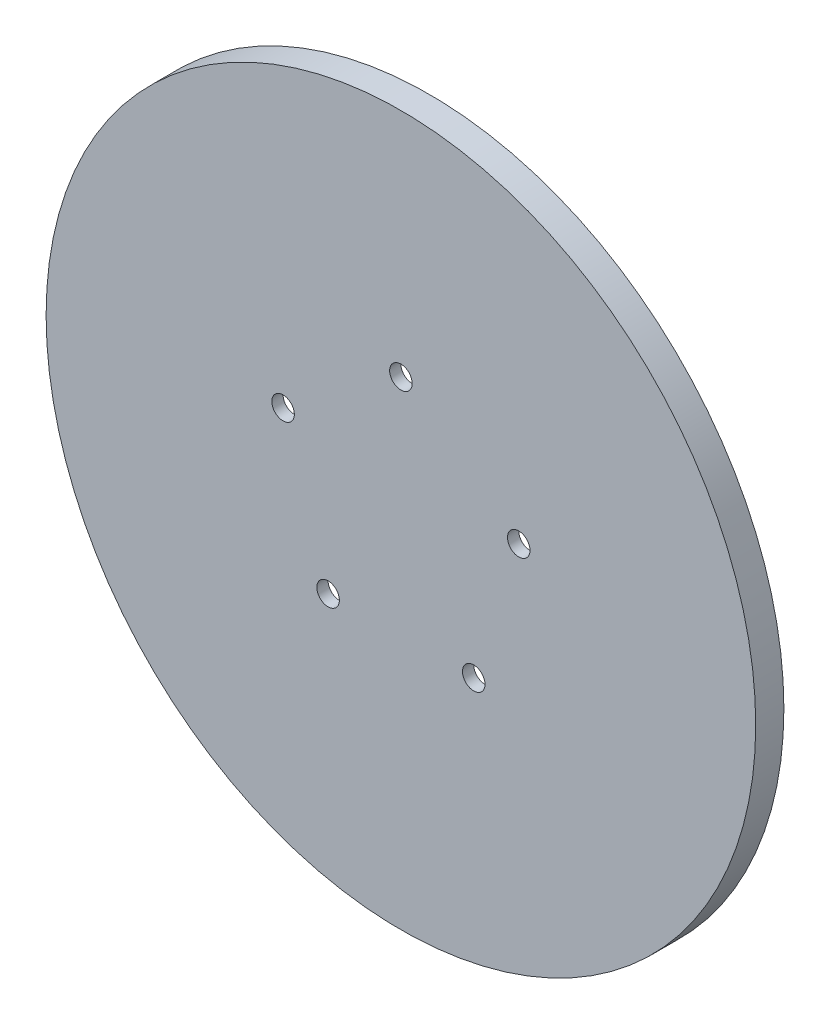
from build123d import *

# Parameters (mm, degrees)
SKETCH1_R           = 7.9375
BOSS_EXTRUDE2_DEPTH = 4.0894
SKETCH4_R           = 80.01
SKETCH4_R_2         = 75.421450769
BOSS_EXTRUDE3_DEPTH = 3.81
BOSS_EXTRUDE5_START = -3.81
BOSS_EXTRUDE5_DEPTH = 3.81
SKETCH6_R           = 80.01
BOSS_EXTRUDE6_DEPTH = 2.54
BOSS_EXTRUDE7_START = 3.81
SKETCH8_R           = 7.9375
BOSS_EXTRUDE7_DEPTH = 3.81
SKETCH9_R           = 2.54
CUT_EXTRUDE2_DEPTH  = 117.930855287


with BuildPart() as part:
    # Sketch1 → Boss-Extrude2 (new body)
    with BuildSketch(Plane.XY):
        with BuildLine():
            Line((-0.762, 75.421450769), (0.762, 75.421450769))
            Line((0.762, 75.421450769), (1.456984931, 73.511995363))
            ThreePointArc((1.456984931, 73.511995363), (2.339997211, 71.173530048), (4.594157789, 70.093302846))
            ThreePointArc((4.594157789, 70.093302846), (6.970031654, 70.870061558), (8.150720614, 73.073264748))
            Line((8.150720614, 73.073264748), (9.088993796, 74.875670761))
            Line((9.088993796, 74.875670761), (10.599955765, 74.676748844))
            Line((10.599955765, 74.676748844), (11.03976106, 72.692915357))
            ThreePointArc((11.03976106, 72.692915357), (11.609988074, 70.259199706), (13.703866053, 68.893987001))
            ThreePointArc((13.703866053, 68.893987001), (16.160801344, 69.353986665), (17.61896507, 71.384230312))
            Line((17.61896507, 71.384230312), (18.784472389, 73.048747266))
            Line((18.784472389, 73.048747266), (20.256543348, 72.654307042))
            Line((20.256543348, 72.654307042), (20.433643817, 70.630039415))
            ThreePointArc((20.433643817, 70.630039415), (20.681328823, 68.142714978), (22.579097369, 66.515875937))
            ThreePointArc((22.579097369, 66.515875937), (25.075055243, 66.651245832), (26.785744149, 68.473791905))
            Line((26.785744149, 68.473791905), (28.15854345, 69.971939453))
            Line((28.15854345, 69.971939453), (29.566535858, 69.388729902))
            Line((29.566535858, 69.388729902), (29.477901263, 67.358663916))
            ThreePointArc((29.477901263, 67.358663916), (29.398806302, 64.860289504), (31.067994069, 62.999659794))
            ThreePointArc((31.067994069, 62.999659794), (33.560267995, 62.808083704), (35.494211718, 64.391747933))
            Line((35.494211718, 64.391747933), (37.050814027, 65.697892356))
            Line((37.050814027, 65.697892356), (38.370636742, 64.935892356))
            Line((38.370636742, 64.935892356), (38.017783645, 62.934763002))
            ThreePointArc((38.017783645, 62.934763002), (37.613262053, 60.468086493), (39.025308777, 58.405502006))
            ThreePointArc((39.025308777, 58.405502006), (41.471255256, 57.89025785), (43.595363485, 59.207943302))
            Line((43.595363485, 59.207943302), (45.309134903, 60.299736106))
            Line((45.309134903, 60.299736106), (46.518205393, 59.371983688))
            Line((46.518205393, 59.371983688), (45.907171209, 57.434030844))
            ThreePointArc((45.907171209, 57.434030844), (45.184144463, 55.041257758), (46.314889632, 52.812009885))
            ThreePointArc((46.314889632, 52.812009885), (48.672657842, 51.981913634), (50.950586495, 53.011074345))
            Line((50.950586495, 53.011074345), (52.792203918, 53.869834653))
            Line((52.792203918, 53.869834653), (53.869834653, 52.792203918))
            Line((53.869834653, 52.792203918), (53.011074345, 50.950586495))
            ThreePointArc((53.011074345, 50.950586495), (51.981913634, 48.672657842), (52.812009885, 46.314889632))
            ThreePointArc((52.812009885, 46.314889632), (55.041257758, 45.184144463), (57.434030844, 45.907171209))
            Line((57.434030844, 45.907171209), (59.371983688, 46.518205393))
            Line((59.371983688, 46.518205393), (60.299736106, 45.309134903))
            Line((60.299736106, 45.309134903), (59.207943302, 43.595363485))
            ThreePointArc((59.207943302, 43.595363485), (57.89025785, 41.471255256), (58.405502006, 39.025308777))
            ThreePointArc((58.405502006, 39.025308777), (60.468086493, 37.613262053), (62.934763002, 38.017783645))
            Line((62.934763002, 38.017783645), (64.935892356, 38.370636742))
            Line((64.935892356, 38.370636742), (65.697892356, 37.050814027))
            Line((65.697892356, 37.050814027), (64.391747933, 35.494211718))
            ThreePointArc((64.391747933, 35.494211718), (62.808083704, 33.560267995), (62.999659794, 31.067994069))
            ThreePointArc((62.999659794, 31.067994069), (64.860289504, 29.398806302), (67.358663916, 29.477901263))
            Line((67.358663916, 29.477901263), (69.388729902, 29.566535858))
            Line((69.388729902, 29.566535858), (69.971939453, 28.15854345))
            Line((69.971939453, 28.15854345), (68.473791905, 26.785744149))
            ThreePointArc((68.473791905, 26.785744149), (66.651245832, 25.075055243), (66.515875937, 22.579097369))
            ThreePointArc((66.515875937, 22.579097369), (68.142714978, 20.681328823), (70.630039415, 20.433643817))
            Line((70.630039415, 20.433643817), (72.654307042, 20.256543348))
            Line((72.654307042, 20.256543348), (73.048747266, 18.784472389))
            Line((73.048747266, 18.784472389), (71.384230312, 17.61896507))
            ThreePointArc((71.384230312, 17.61896507), (69.353986665, 16.160801344), (68.893987001, 13.703866053))
            ThreePointArc((68.893987001, 13.703866053), (70.259199706, 11.609988074), (72.692915357, 11.03976106))
            Line((72.692915357, 11.03976106), (74.676748844, 10.599955765))
            Line((74.676748844, 10.599955765), (74.875670761, 9.088993796))
            Line((74.875670761, 9.088993796), (73.073264748, 8.150720614))
            ThreePointArc((73.073264748, 8.150720614), (70.870061558, 6.970031654), (70.093302846, 4.594157789))
            ThreePointArc((70.093302846, 4.594157789), (71.173530048, 2.339997211), (73.511995363, 1.456984931))
            Line((73.511995363, 1.456984931), (75.421450769, 0.762))
            Line((75.421450769, 0.762), (75.421450769, -0.762))
            Line((75.421450769, -0.762), (73.511995363, -1.456984931))
            ThreePointArc((73.511995363, -1.456984931), (71.173530048, -2.339997211), (70.093302846, -4.594157789))
            ThreePointArc((70.093302846, -4.594157789), (70.870061558, -6.970031654), (73.073264748, -8.150720614))
            Line((73.073264748, -8.150720614), (74.875670761, -9.088993796))
            Line((74.875670761, -9.088993796), (74.676748844, -10.599955765))
            Line((74.676748844, -10.599955765), (72.692915357, -11.03976106))
            ThreePointArc((72.692915357, -11.03976106), (70.259199706, -11.609988074), (68.893987001, -13.703866053))
            ThreePointArc((68.893987001, -13.703866053), (69.353986665, -16.160801344), (71.384230312, -17.61896507))
            Line((71.384230312, -17.61896507), (73.048747266, -18.784472389))
            Line((73.048747266, -18.784472389), (72.654307042, -20.256543348))
            Line((72.654307042, -20.256543348), (70.630039415, -20.433643817))
            ThreePointArc((70.630039415, -20.433643817), (68.142714978, -20.681328823), (66.515875937, -22.579097369))
            ThreePointArc((66.515875937, -22.579097369), (66.651245832, -25.075055243), (68.473791905, -26.785744149))
            Line((68.473791905, -26.785744149), (69.971939453, -28.15854345))
            Line((69.971939453, -28.15854345), (69.388729902, -29.566535858))
            Line((69.388729902, -29.566535858), (67.358663916, -29.477901263))
            ThreePointArc((67.358663916, -29.477901263), (64.860289504, -29.398806302), (62.999659794, -31.067994069))
            ThreePointArc((62.999659794, -31.067994069), (62.808083704, -33.560267995), (64.391747933, -35.494211718))
            Line((64.391747933, -35.494211718), (65.697892356, -37.050814027))
            Line((65.697892356, -37.050814027), (64.935892356, -38.370636742))
            Line((64.935892356, -38.370636742), (62.934763002, -38.017783645))
            ThreePointArc((62.934763002, -38.017783645), (60.468086493, -37.613262053), (58.405502006, -39.025308777))
            ThreePointArc((58.405502006, -39.025308777), (57.89025785, -41.471255256), (59.207943302, -43.595363485))
            Line((59.207943302, -43.595363485), (60.299736106, -45.309134903))
            Line((60.299736106, -45.309134903), (59.371983688, -46.518205393))
            Line((59.371983688, -46.518205393), (57.434030844, -45.907171209))
            ThreePointArc((57.434030844, -45.907171209), (55.041257758, -45.184144463), (52.812009885, -46.314889632))
            ThreePointArc((52.812009885, -46.314889632), (51.981913634, -48.672657842), (53.011074345, -50.950586495))
            Line((53.011074345, -50.950586495), (53.869834653, -52.792203918))
            Line((53.869834653, -52.792203918), (52.792203918, -53.869834653))
            Line((52.792203918, -53.869834653), (50.950586495, -53.011074345))
            ThreePointArc((50.950586495, -53.011074345), (48.672657842, -51.981913634), (46.314889632, -52.812009885))
            ThreePointArc((46.314889632, -52.812009885), (45.184144463, -55.041257758), (45.907171209, -57.434030844))
            Line((45.907171209, -57.434030844), (46.518205393, -59.371983688))
            Line((46.518205393, -59.371983688), (45.309134903, -60.299736106))
            Line((45.309134903, -60.299736106), (43.595363485, -59.207943302))
            ThreePointArc((43.595363485, -59.207943302), (41.471255256, -57.89025785), (39.025308777, -58.405502006))
            ThreePointArc((39.025308777, -58.405502006), (37.613262053, -60.468086493), (38.017783645, -62.934763002))
            Line((38.017783645, -62.934763002), (38.370636742, -64.935892356))
            Line((38.370636742, -64.935892356), (37.050814027, -65.697892356))
            Line((37.050814027, -65.697892356), (35.494211718, -64.391747933))
            ThreePointArc((35.494211718, -64.391747933), (33.560267995, -62.808083704), (31.067994069, -62.999659794))
            ThreePointArc((31.067994069, -62.999659794), (29.398806302, -64.860289504), (29.477901263, -67.358663916))
            Line((29.477901263, -67.358663916), (29.566535858, -69.388729902))
            Line((29.566535858, -69.388729902), (28.15854345, -69.971939453))
            Line((28.15854345, -69.971939453), (26.785744149, -68.473791905))
            ThreePointArc((26.785744149, -68.473791905), (25.075055243, -66.651245832), (22.579097369, -66.515875937))
            ThreePointArc((22.579097369, -66.515875937), (20.681328823, -68.142714978), (20.433643817, -70.630039415))
            Line((20.433643817, -70.630039415), (20.256543348, -72.654307042))
            Line((20.256543348, -72.654307042), (18.784472389, -73.048747266))
            Line((18.784472389, -73.048747266), (17.61896507, -71.384230312))
            ThreePointArc((17.61896507, -71.384230312), (16.160801344, -69.353986665), (13.703866053, -68.893987001))
            ThreePointArc((13.703866053, -68.893987001), (11.609988074, -70.259199706), (11.03976106, -72.692915357))
            Line((11.03976106, -72.692915357), (10.599955765, -74.676748844))
            Line((10.599955765, -74.676748844), (9.088993796, -74.875670761))
            Line((9.088993796, -74.875670761), (8.150720614, -73.073264748))
            ThreePointArc((8.150720614, -73.073264748), (6.970031654, -70.870061558), (4.594157789, -70.093302846))
            ThreePointArc((4.594157789, -70.093302846), (2.339997211, -71.173530048), (1.456984931, -73.511995363))
            Line((1.456984931, -73.511995363), (0.762, -75.421450769))
            Line((0.762, -75.421450769), (-0.762, -75.421450769))
            Line((-0.762, -75.421450769), (-1.456984931, -73.511995363))
            ThreePointArc((-1.456984931, -73.511995363), (-2.339997211, -71.173530048), (-4.594157789, -70.093302846))
            ThreePointArc((-4.594157789, -70.093302846), (-6.970031654, -70.870061558), (-8.150720614, -73.073264748))
            Line((-8.150720614, -73.073264748), (-9.088993796, -74.875670761))
            Line((-9.088993796, -74.875670761), (-10.599955765, -74.676748844))
            Line((-10.599955765, -74.676748844), (-11.03976106, -72.692915357))
            ThreePointArc((-11.03976106, -72.692915357), (-11.609988074, -70.259199706), (-13.703866053, -68.893987001))
            ThreePointArc((-13.703866053, -68.893987001), (-16.160801344, -69.353986665), (-17.61896507, -71.384230312))
            Line((-17.61896507, -71.384230312), (-18.784472389, -73.048747266))
            Line((-18.784472389, -73.048747266), (-20.256543348, -72.654307042))
            Line((-20.256543348, -72.654307042), (-20.433643817, -70.630039415))
            ThreePointArc((-20.433643817, -70.630039415), (-20.681328823, -68.142714978), (-22.579097369, -66.515875937))
            ThreePointArc((-22.579097369, -66.515875937), (-25.075055243, -66.651245832), (-26.785744149, -68.473791905))
            Line((-26.785744149, -68.473791905), (-28.15854345, -69.971939453))
            Line((-28.15854345, -69.971939453), (-29.566535858, -69.388729902))
            Line((-29.566535858, -69.388729902), (-29.477901263, -67.358663916))
            ThreePointArc((-29.477901263, -67.358663916), (-29.398806302, -64.860289504), (-31.067994069, -62.999659794))
            ThreePointArc((-31.067994069, -62.999659794), (-33.560267995, -62.808083704), (-35.494211718, -64.391747933))
            Line((-35.494211718, -64.391747933), (-37.050814027, -65.697892356))
            Line((-37.050814027, -65.697892356), (-38.370636742, -64.935892356))
            Line((-38.370636742, -64.935892356), (-38.017783645, -62.934763002))
            ThreePointArc((-38.017783645, -62.934763002), (-37.613262053, -60.468086493), (-39.025308777, -58.405502006))
            ThreePointArc((-39.025308777, -58.405502006), (-41.471255256, -57.89025785), (-43.595363485, -59.207943302))
            Line((-43.595363485, -59.207943302), (-45.309134903, -60.299736106))
            Line((-45.309134903, -60.299736106), (-46.518205393, -59.371983688))
            Line((-46.518205393, -59.371983688), (-45.907171209, -57.434030844))
            ThreePointArc((-45.907171209, -57.434030844), (-45.184144463, -55.041257758), (-46.314889632, -52.812009885))
            ThreePointArc((-46.314889632, -52.812009885), (-48.672657842, -51.981913634), (-50.950586495, -53.011074345))
            Line((-50.950586495, -53.011074345), (-52.792203918, -53.869834653))
            Line((-52.792203918, -53.869834653), (-53.869834653, -52.792203918))
            Line((-53.869834653, -52.792203918), (-53.011074345, -50.950586495))
            ThreePointArc((-53.011074345, -50.950586495), (-51.981913634, -48.672657842), (-52.812009885, -46.314889632))
            ThreePointArc((-52.812009885, -46.314889632), (-55.041257758, -45.184144463), (-57.434030844, -45.907171209))
            Line((-57.434030844, -45.907171209), (-59.371983688, -46.518205393))
            Line((-59.371983688, -46.518205393), (-60.299736106, -45.309134903))
            Line((-60.299736106, -45.309134903), (-59.207943302, -43.595363485))
            ThreePointArc((-59.207943302, -43.595363485), (-57.89025785, -41.471255256), (-58.405502006, -39.025308777))
            ThreePointArc((-58.405502006, -39.025308777), (-60.468086493, -37.613262053), (-62.934763002, -38.017783645))
            Line((-62.934763002, -38.017783645), (-64.935892356, -38.370636742))
            Line((-64.935892356, -38.370636742), (-65.697892356, -37.050814027))
            Line((-65.697892356, -37.050814027), (-64.391747933, -35.494211718))
            ThreePointArc((-64.391747933, -35.494211718), (-62.808083704, -33.560267995), (-62.999659794, -31.067994069))
            ThreePointArc((-62.999659794, -31.067994069), (-64.860289504, -29.398806302), (-67.358663916, -29.477901263))
            Line((-67.358663916, -29.477901263), (-69.388729902, -29.566535858))
            Line((-69.388729902, -29.566535858), (-69.971939453, -28.15854345))
            Line((-69.971939453, -28.15854345), (-68.473791905, -26.785744149))
            ThreePointArc((-68.473791905, -26.785744149), (-66.651245832, -25.075055243), (-66.515875937, -22.579097369))
            ThreePointArc((-66.515875937, -22.579097369), (-68.142714978, -20.681328823), (-70.630039415, -20.433643817))
            Line((-70.630039415, -20.433643817), (-72.654307042, -20.256543348))
            Line((-72.654307042, -20.256543348), (-73.048747266, -18.784472389))
            Line((-73.048747266, -18.784472389), (-71.384230312, -17.61896507))
            ThreePointArc((-71.384230312, -17.61896507), (-69.353986665, -16.160801344), (-68.893987001, -13.703866053))
            ThreePointArc((-68.893987001, -13.703866053), (-70.259199706, -11.609988074), (-72.692915357, -11.03976106))
            Line((-72.692915357, -11.03976106), (-74.676748844, -10.599955765))
            Line((-74.676748844, -10.599955765), (-74.875670761, -9.088993796))
            Line((-74.875670761, -9.088993796), (-73.073264748, -8.150720614))
            ThreePointArc((-73.073264748, -8.150720614), (-70.870061558, -6.970031654), (-70.093302846, -4.594157789))
            ThreePointArc((-70.093302846, -4.594157789), (-71.173530048, -2.339997211), (-73.511995363, -1.456984931))
            Line((-73.511995363, -1.456984931), (-75.421450769, -0.762))
            Line((-75.421450769, -0.762), (-75.421450769, 0.762))
            Line((-75.421450769, 0.762), (-73.511995363, 1.456984931))
            ThreePointArc((-73.511995363, 1.456984931), (-71.173530048, 2.339997211), (-70.093302846, 4.594157789))
            ThreePointArc((-70.093302846, 4.594157789), (-70.870061558, 6.970031654), (-73.073264748, 8.150720614))
            Line((-73.073264748, 8.150720614), (-74.875670761, 9.088993796))
            Line((-74.875670761, 9.088993796), (-74.676748844, 10.599955765))
            Line((-74.676748844, 10.599955765), (-72.692915357, 11.03976106))
            ThreePointArc((-72.692915357, 11.03976106), (-70.259199706, 11.609988074), (-68.893987001, 13.703866053))
            ThreePointArc((-68.893987001, 13.703866053), (-69.353986665, 16.160801344), (-71.384230312, 17.61896507))
            Line((-71.384230312, 17.61896507), (-73.048747266, 18.784472389))
            Line((-73.048747266, 18.784472389), (-72.654307042, 20.256543348))
            Line((-72.654307042, 20.256543348), (-70.630039415, 20.433643817))
            ThreePointArc((-70.630039415, 20.433643817), (-68.142714978, 20.681328823), (-66.515875937, 22.579097369))
            ThreePointArc((-66.515875937, 22.579097369), (-66.651245832, 25.075055243), (-68.473791905, 26.785744149))
            Line((-68.473791905, 26.785744149), (-69.971939453, 28.15854345))
            Line((-69.971939453, 28.15854345), (-69.388729902, 29.566535858))
            Line((-69.388729902, 29.566535858), (-67.358663916, 29.477901263))
            ThreePointArc((-67.358663916, 29.477901263), (-64.860289504, 29.398806302), (-62.999659794, 31.067994069))
            ThreePointArc((-62.999659794, 31.067994069), (-62.808083704, 33.560267995), (-64.391747933, 35.494211718))
            Line((-64.391747933, 35.494211718), (-65.697892356, 37.050814027))
            Line((-65.697892356, 37.050814027), (-64.935892356, 38.370636742))
            Line((-64.935892356, 38.370636742), (-62.934763002, 38.017783645))
            ThreePointArc((-62.934763002, 38.017783645), (-60.468086493, 37.613262053), (-58.405502006, 39.025308777))
            ThreePointArc((-58.405502006, 39.025308777), (-57.89025785, 41.471255256), (-59.207943302, 43.595363485))
            Line((-59.207943302, 43.595363485), (-60.299736106, 45.309134903))
            Line((-60.299736106, 45.309134903), (-59.371983688, 46.518205393))
            Line((-59.371983688, 46.518205393), (-57.434030844, 45.907171209))
            ThreePointArc((-57.434030844, 45.907171209), (-55.041257758, 45.184144463), (-52.812009885, 46.314889632))
            ThreePointArc((-52.812009885, 46.314889632), (-51.981913634, 48.672657842), (-53.011074345, 50.950586495))
            Line((-53.011074345, 50.950586495), (-53.869834653, 52.792203918))
            Line((-53.869834653, 52.792203918), (-52.792203918, 53.869834653))
            Line((-52.792203918, 53.869834653), (-50.950586495, 53.011074345))
            ThreePointArc((-50.950586495, 53.011074345), (-48.672657842, 51.981913634), (-46.314889632, 52.812009885))
            ThreePointArc((-46.314889632, 52.812009885), (-45.184144463, 55.041257758), (-45.907171209, 57.434030844))
            Line((-45.907171209, 57.434030844), (-46.518205393, 59.371983688))
            Line((-46.518205393, 59.371983688), (-45.309134903, 60.299736106))
            Line((-45.309134903, 60.299736106), (-43.595363485, 59.207943302))
            ThreePointArc((-43.595363485, 59.207943302), (-41.471255256, 57.89025785), (-39.025308777, 58.405502006))
            ThreePointArc((-39.025308777, 58.405502006), (-37.613262053, 60.468086493), (-38.017783645, 62.934763002))
            Line((-38.017783645, 62.934763002), (-38.370636742, 64.935892356))
            Line((-38.370636742, 64.935892356), (-37.050814027, 65.697892356))
            Line((-37.050814027, 65.697892356), (-35.494211718, 64.391747933))
            ThreePointArc((-35.494211718, 64.391747933), (-33.560267995, 62.808083704), (-31.067994069, 62.999659794))
            ThreePointArc((-31.067994069, 62.999659794), (-29.398806302, 64.860289504), (-29.477901263, 67.358663916))
            Line((-29.477901263, 67.358663916), (-29.566535858, 69.388729902))
            Line((-29.566535858, 69.388729902), (-28.15854345, 69.971939453))
            Line((-28.15854345, 69.971939453), (-26.785744149, 68.473791905))
            ThreePointArc((-26.785744149, 68.473791905), (-25.075055243, 66.651245832), (-22.579097369, 66.515875937))
            ThreePointArc((-22.579097369, 66.515875937), (-20.681328823, 68.142714978), (-20.433643817, 70.630039415))
            Line((-20.433643817, 70.630039415), (-20.256543348, 72.654307042))
            Line((-20.256543348, 72.654307042), (-18.784472389, 73.048747266))
            Line((-18.784472389, 73.048747266), (-17.61896507, 71.384230312))
            ThreePointArc((-17.61896507, 71.384230312), (-16.160801344, 69.353986665), (-13.703866053, 68.893987001))
            ThreePointArc((-13.703866053, 68.893987001), (-11.609988074, 70.259199706), (-11.03976106, 72.692915357))
            Line((-11.03976106, 72.692915357), (-10.599955765, 74.676748844))
            Line((-10.599955765, 74.676748844), (-9.088993796, 74.875670761))
            Line((-9.088993796, 74.875670761), (-8.150720614, 73.073264748))
            ThreePointArc((-8.150720614, 73.073264748), (-6.970031654, 70.870061558), (-4.594157789, 70.093302846))
            ThreePointArc((-4.594157789, 70.093302846), (-2.339997211, 71.173530048), (-1.456984931, 73.511995363))
            Line((-1.456984931, 73.511995363), (-0.762, 75.421450769))
        make_face()
        Circle(SKETCH1_R, mode=Mode.SUBTRACT)
    extrude(amount=BOSS_EXTRUDE2_DEPTH)

    # Sketch3 → Cut-Revolve3 (revolve, cut)
    with BuildSketch(Plane(origin=(0, 0, 0), x_dir=(0, 0, -1), z_dir=(1, 0, 0))):
        Polygon((-4.752293352, 76.364789012), (-4.752293352, 70.630039415), (-4.0894, 70.630039415), (-3.848714616, 73.457461189), (-3.3274, 75.421450769), (-3.3274, 76.364789012), align=None)
        Polygon((-0.762, 75.421450769), (-0.762, 76.364789012), (0.662893352, 76.364789012), (0.662893352, 70.630039415), (0, 70.630039415), (-0.240685384, 73.457461189), align=None)
    revolve(axis=Axis((0, 0, 4.0894), (0, 0, -1)), mode=Mode.SUBTRACT)


with BuildPart() as body_2:
    # Sketch4 → Boss-Extrude3 (new body)
    with BuildSketch(Plane.XY.offset(29.4894)):
        with Locations(Location((0, 0, 0), (0, 0, 180))):
            Circle(SKETCH4_R)
        with Locations(Location((0, 0, 0), (0, 0, 180))):
            Circle(SKETCH4_R_2, mode=Mode.SUBTRACT)
    extrude(amount=BOSS_EXTRUDE3_DEPTH)

    # Sketch5 → Boss-Extrude5 (add)
    with BuildSketch(Plane.XY.offset(33.2994).offset(BOSS_EXTRUDE5_START)):
        with BuildLine():
            Line((-45.305667206, 60.29752694), (-43.553929762, 59.152800496))
            ThreePointArc((-43.553929762, 59.152800496), (-39.025308777, 58.405502006), (-37.982694335, 62.875380996))
            Line((-37.982694335, 62.875380996), (-38.369922769, 64.931843211))
            ThreePointArc((-38.369922769, 64.931843211), (-41.901912978, 62.71064443), (-45.305667206, 60.29752694))
        make_face()
        with BuildLine():
            Line((60.29752694, 45.305667206), (59.152800496, 43.553929762))
            ThreePointArc((59.152800496, 43.553929762), (58.405502006, 39.025308777), (62.875380996, 37.982694335))
            Line((62.875380996, 37.982694335), (64.931843211, 38.369922769))
            ThreePointArc((64.931843211, 38.369922769), (62.71064443, 41.901912978), (60.29752694, 45.305667206))
        make_face()
        with BuildLine():
            Line((45.305667206, -60.29752694), (43.553929762, -59.152800496))
            ThreePointArc((43.553929762, -59.152800496), (39.025308777, -58.405502006), (37.982694335, -62.875380996))
            Line((37.982694335, -62.875380996), (38.369922769, -64.931843211))
            ThreePointArc((38.369922769, -64.931843211), (41.901912978, -62.71064443), (45.305667206, -60.29752694))
        make_face()
        with BuildLine():
            Line((-60.29752694, -45.305667206), (-59.152800496, -43.553929762))
            ThreePointArc((-59.152800496, -43.553929762), (-58.405502006, -39.025308777), (-62.875380996, -37.982694335))
            Line((-62.875380996, -37.982694335), (-64.931843211, -38.369922769))
            ThreePointArc((-64.931843211, -38.369922769), (-62.71064443, -41.901912978), (-60.29752694, -45.305667206))
        make_face()
    extrude(amount=BOSS_EXTRUDE5_DEPTH)

    # Sketch6 → Boss-Extrude6 (add)
    with BuildSketch(Plane.XY.offset(33.2994)):
        with Locations(Location((0, 0, 0), (0, 0, 180))):
            Circle(SKETCH6_R)
    extrude(amount=BOSS_EXTRUDE6_DEPTH)

    # Sketch8 → Boss-Extrude7 (add)
    with BuildSketch(Plane(origin=(0, 0, 33.2994), x_dir=(-1, 0, 0), z_dir=(0, 0, -1)).offset(BOSS_EXTRUDE7_START)):
        with Locations(Location((0, 0, 0), (0, 0, 180))):
            Circle(SKETCH8_R)
    extrude(amount=-BOSS_EXTRUDE7_DEPTH)

    # Sketch9 → Cut-Extrude2 (cut, through all)
    with BuildSketch(Plane(origin=(0, 0, 29.4894), x_dir=(-1, 0, 0), z_dir=(0, 0, -1))):
        with Locations((0, 27.94)):
            Circle(SKETCH9_R)
        with Locations((26.572519065, 8.633934823)):
            Circle(SKETCH9_R)
        with Locations((16.422719949, -22.603934823)):
            Circle(SKETCH9_R)
        with Locations((-16.422719949, -22.603934823)):
            Circle(SKETCH9_R)
        with Locations((-26.572519065, 8.633934823)):
            Circle(SKETCH9_R)
    extrude(amount=-CUT_EXTRUDE2_DEPTH, mode=Mode.SUBTRACT)


solid = body_2.part
